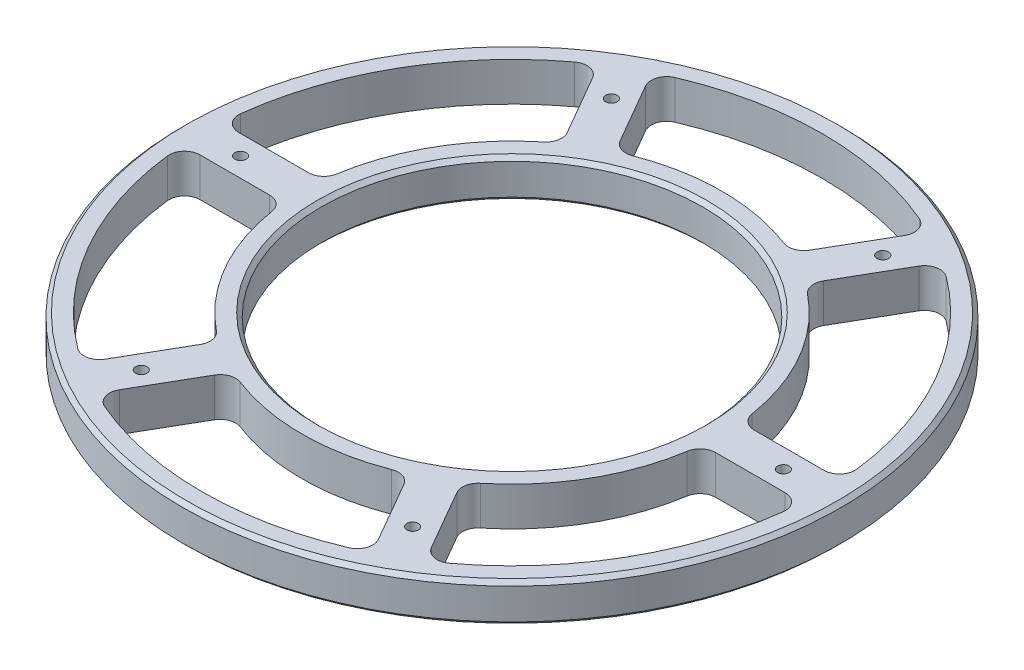
from build123d import *

# Parameters (mm, degrees)
SKETCH2_W                   = 35.78733
SKETCH2_H                   = 10
F_32_0_116_DIAMETER_HOLE1_D = 2.9464
CIRPATTERN3_COUNT           = 6
CUT_EXTRUDE1_DEPTH          = 121.623141229
FILLET1_R                   = 4
CIRPATTERN4_COUNT           = 6
FILLET1_OF_CIRPATTERN4_R    = 4
CHAMFER1_SIZE               = 1
CHAMFER2_SIZE               = 1


with BuildPart() as part:
    # Sketch2 → Revolve1 (revolve)
    with BuildSketch(Plane(origin=(0, 0, 0), x_dir=(0, 0, -1), z_dir=(1, 0, 0))):
        with Locations((-67.106165, 5)):
            Rectangle(SKETCH2_W, SKETCH2_H)
    revolve(axis=Axis((0, -0.75, 0), (0, 1, 0)))

    # #32 (0.116) Diameter Hole1 (through all)
    with Locations(Plane(origin=(0, 10, 0), x_dir=(1, 0, 0), z_dir=(0, 1, 0))):
        with Locations((-35, 60.621778265)):
            f_32_0_116_diameter_hole1 = Hole(F_32_0_116_DIAMETER_HOLE1_D / 2)

    # CirPattern3: #32 (0.116) Diameter Hole1 ×6 about axis
    cirpattern3_axis = Axis((0, -0.75, 0), (0, 1, 0))
    for i in range(1, CIRPATTERN3_COUNT):
        add(f_32_0_116_diameter_hole1.rotate(cirpattern3_axis, i * 360 / CIRPATTERN3_COUNT), mode=Mode.SUBTRACT)

    # Sketch8 → Cut-Extrude1 (cut, through all)
    with BuildSketch(Plane(origin=(0, 10, 0), x_dir=(1, 0, 0), z_dir=(0, 1, 0))):
        with BuildLine():
            Line((-22.660589701, 49.249292692), (-35.591586371, 71.646435917))
            ThreePointArc((-35.591586371, 71.646435917), (0, 79.99983), (35.591586371, 71.646435917))
            Line((35.591586371, 71.646435917), (22.660589701, 49.249292692))
            ThreePointArc((22.660589701, 49.249292692), (0, 54.2125), (-22.660589701, 49.249292692))
        make_face()
    cut_extrude1 = extrude(amount=-CUT_EXTRUDE1_DEPTH, mode=Mode.SUBTRACT)

    # Fillet1
    fillet1_edges = [part.edges().sort_by_distance(p)[0] for p in [
        (-22.660589701, 5, -49.249292692),
        (22.660589701, 5, -49.249292692),
        (35.591586371, 5, -71.646435917),
        (-35.591586371, 5, -71.646435917),
    ]]
    fillet(fillet1_edges, radius=FILLET1_R)

    # CirPattern4: Cut-Extrude1 ×6 about axis
    cirpattern4_axis = Axis((0, -0.75, 0), (0, 1, 0))
    for i in range(1, CIRPATTERN4_COUNT):
        add(cut_extrude1.rotate(cirpattern4_axis, i * 360 / CIRPATTERN4_COUNT), mode=Mode.SUBTRACT)

    # Fillet1 of CirPattern4
    fillet1_of_cirpattern4_edges = [part.edges().sort_by_distance(p)[0] for p in [
        (-53.98143344, 5, -5),
        (-31.320843739, 5, -44.249292692),
        (-44.251840409, 5, -66.646435917),
        (-79.84342678, 5, -5),
        (-31.320843739, 5, 44.249292692),
        (-53.98143344, 5, 5),
        (-79.84342678, 5, 5),
        (-44.251840409, 5, 66.646435917),
        (22.660589701, 5, 49.249292692),
        (-22.660589701, 5, 49.249292692),
        (-35.591586371, 5, 71.646435917),
        (35.591586371, 5, 71.646435917),
        (53.98143344, 5, 5),
        (31.320843739, 5, 44.249292692),
        (44.251840409, 5, 66.646435917),
        (79.84342678, 5, 5),
        (31.320843739, 5, -44.249292692),
        (53.98143344, 5, -5),
        (79.84342678, 5, -5),
        (44.251840409, 5, -66.646435917),
    ]]
    fillet(fillet1_of_cirpattern4_edges, radius=FILLET1_OF_CIRPATTERN4_R)

    # Chamfer1
    chamfer1_edges = [part.edges().sort_by_distance(p)[0] for p in [
        (0, 10, -49.2125),
        (0, 0, -49.2125),
    ]]
    chamfer(chamfer1_edges, length=CHAMFER1_SIZE)

    # Chamfer2
    chamfer2_edges = [part.edges().sort_by_distance(p)[0] for p in [
        (0, 10, -84.99983),
        (0, 0, -84.99983),
    ]]
    chamfer(chamfer2_edges, length=CHAMFER2_SIZE)


solid = part.part
